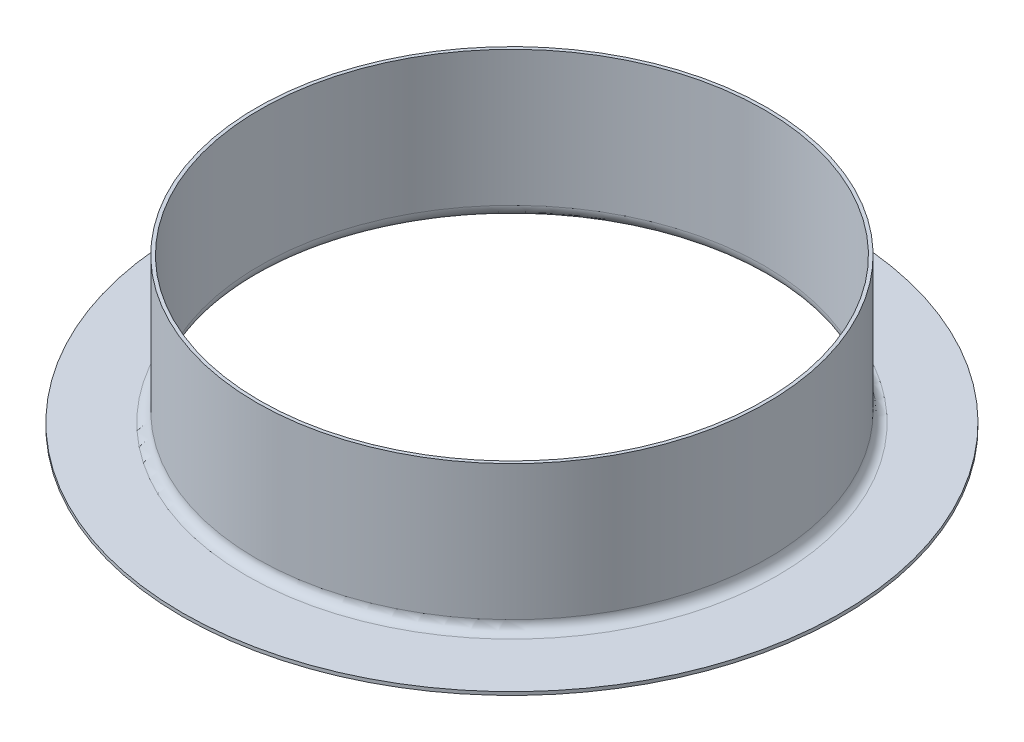
from build123d import *

# Parameters (mm, degrees)
SKETCH15_R         = 100
SKETCH15_R_2       = 81.5
BASE_FLANGE1_DEPTH = 1


# Read off the part's stored shape, not the designer's step: Edge-Flange1
# Sheet-metal steps are written as plain solids
with BuildPart() as part:
    # Sketch15 → Base-Flange1 (new body)
    with BuildSketch(Plane(origin=(0, 0, 0), x_dir=(1, 0, 0), z_dir=(0, 1, 0))):
        with Locations(Location((0, 0, 0), (0, 0, 270))):
            Circle(SKETCH15_R)
        with Locations(Location((0, 0, 0), (0, 0, 270))):
            Circle(SKETCH15_R_2, mode=Mode.SUBTRACT)
    extrude(amount=-BASE_FLANGE1_DEPTH)

    # Edge-Flange1 outline → Edge-Flange1 (revolve)
    with BuildSketch(Plane.XY):
        with BuildLine():
            Line((80.5, -1), (81.5, -1))
            Line((81.5, -1), (81.5, 0))
            Line((81.5, 0), (80.5, 0))
            ThreePointArc((80.5, 0), (78.378679656, 0.878679656), (77.5, 3))
            Line((77.5, 3), (77.5, 44))
            Line((77.5, 44), (76.5, 44))
            Line((76.5, 44), (76.5, 3))
            ThreePointArc((76.5, 3), (77.671572875, 0.171572875), (80.5, -1))
        make_face()
    revolve(axis=Axis((0, 0, 0), (0, 1, 0)))


solid = part.part
